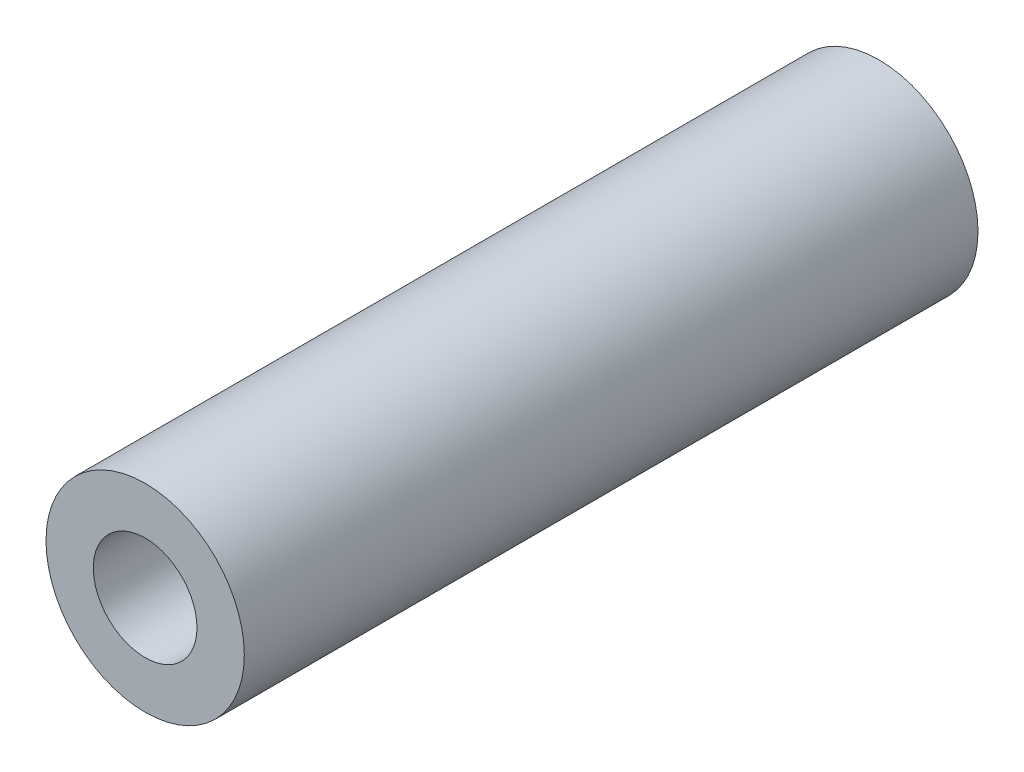
from build123d import *

# Parameters (mm, degrees)
SKETCH1_R           = 4.7625
SKETCH1_R_2         = 2.4892
BOSS_EXTRUDE1_DEPTH = 17.62125


with BuildPart() as part:
    # Sketch1 → Boss-Extrude1 (new, symmetric)
    with BuildSketch(Plane.XY):
        Circle(SKETCH1_R)
        Circle(SKETCH1_R_2, mode=Mode.SUBTRACT)
    extrude(amount=BOSS_EXTRUDE1_DEPTH, both=True)


solid = part.part
